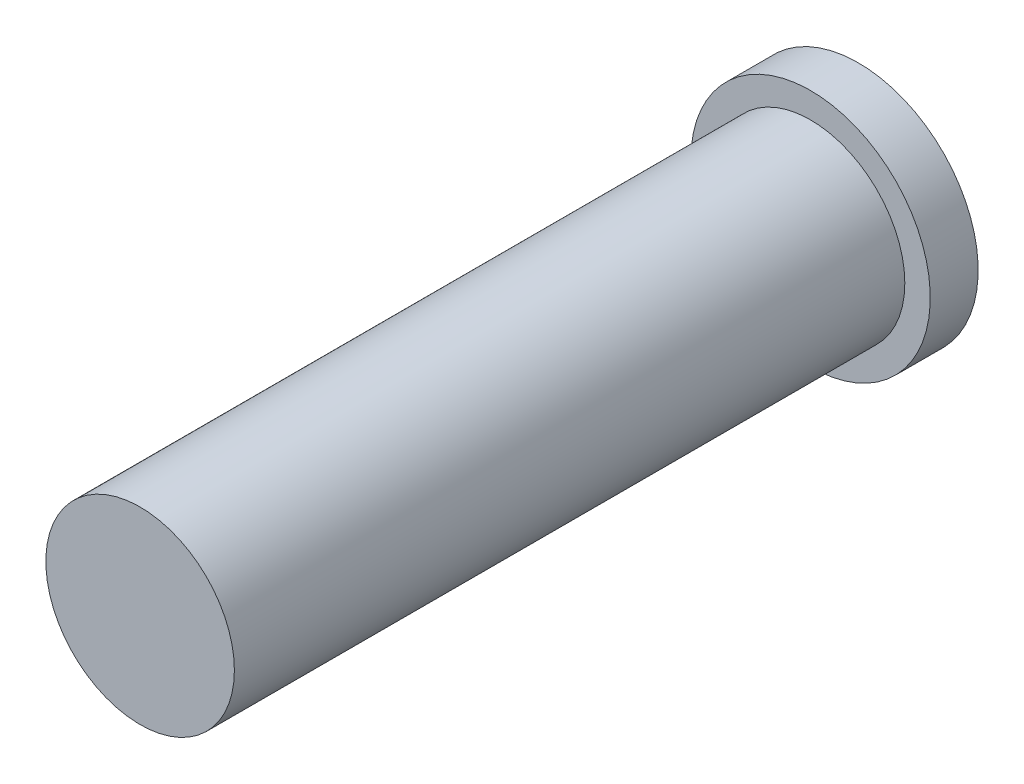
from build123d import *

# Parameters (mm, degrees)
SKETCH2_R               = 5
BOSS_EXTRUDE1_DEPTH     = 35.56
CUT_EXTRUDE1_DEPTH      = 25.4
CUT_EXTRUDE1_DEPTH_BACK = 41.435980969
SKETCH3_R               = 6.35
BOSS_EXTRUDE2_DEPTH     = 2.54
CUT_EXTRUDE2_DEPTH      = 2.54
SKETCH5_R               = 2.5
CUT_EXTRUDE3_DEPTH      = 28.575


with BuildPart() as part:
    # Sketch2 → Boss-Extrude1 (new body)
    with BuildSketch(Plane.XY):
        with Locations((13.074576669, 1.623038211)):
            Circle(SKETCH2_R)
    extrude(amount=BOSS_EXTRUDE1_DEPTH)

    # Sketch1 → Cut-Extrude1 (cut, two sides: drawn at the far end of the back side and taken through both)
    with BuildSketch(Plane.XY.offset(-CUT_EXTRUDE1_DEPTH_BACK)):
        with BuildLine():
            Line((15.515382974, 2.163838155), (14.277170381, -0.568711858))
            ThreePointArc((14.277170381, -0.568711858), (10.797451658, 2.654882038), (15.515382974, 2.163838155))
        make_face()
    extrude(amount=CUT_EXTRUDE1_DEPTH + CUT_EXTRUDE1_DEPTH_BACK, mode=Mode.SUBTRACT)

    # Sketch3 → Boss-Extrude2 (add)
    with BuildSketch(Plane(origin=(0, 0, 0), x_dir=(-1, 0, 0), z_dir=(0, 0, -1))):
        with Locations((-13.074576669, 1.623038211)):
            Circle(SKETCH3_R)
    extrude(amount=BOSS_EXTRUDE2_DEPTH)

    # Sketch4 → Cut-Extrude2 (cut)
    with BuildSketch(Plane(origin=(0, 0, -2.54), x_dir=(-1, 0, 0), z_dir=(0, 0, -1))):
        with BuildLine():
            Line((-15.515382974, 2.163838155), (-14.277170381, -0.568711858))
            ThreePointArc((-14.277170381, -0.568711858), (-10.797451658, 2.654882038), (-15.515382974, 2.163838155))
        make_face()
    extrude(amount=-CUT_EXTRUDE2_DEPTH, mode=Mode.SUBTRACT)

    # Sketch5 → Cut-Extrude3 (cut)
    with BuildSketch(Plane(origin=(0, 0, -2.54), x_dir=(-1, 0, 0), z_dir=(0, 0, -1))):
        with Locations((-13.074576669, 1.623038211)):
            Circle(SKETCH5_R)
    extrude(amount=-CUT_EXTRUDE3_DEPTH, mode=Mode.SUBTRACT)


solid = part.part
